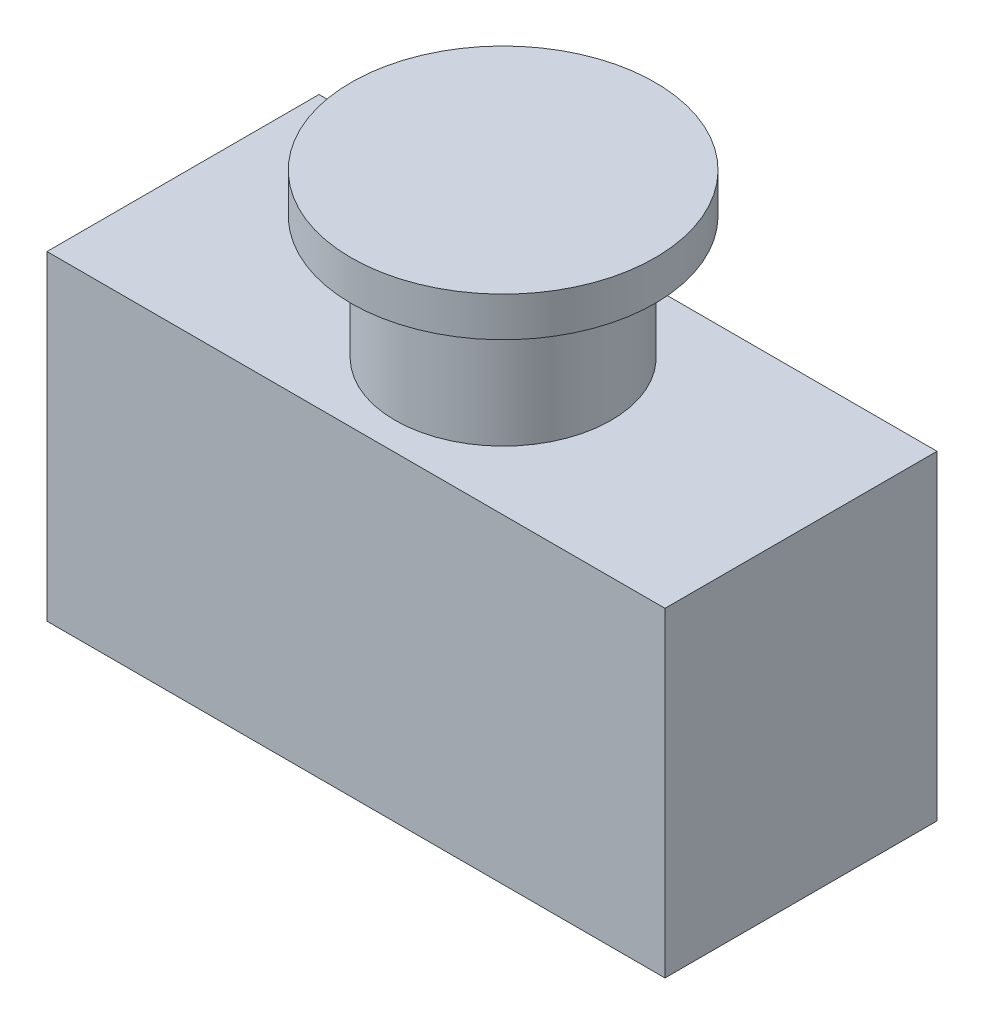
from build123d import *

# Parameters (mm, degrees)
SKETCH1_W      = 309.88
SKETCH1_H      = 136.398
EXTRUDE1_DEPTH = 160.528
SKETCH2_R      = 54.23826071
EXTRUDE2_DEPTH = 81.534
SKETCH3_R      = 76.2
EXTRUDE3_DEPTH = 19.812


with BuildPart() as part:
    # Sketch1 → Extrude1 (new body)
    with BuildSketch(Plane(origin=(0, 0, 0), x_dir=(1, 0, 0), z_dir=(0, 1, 0))):
        with Locations((120.827186097, -35.645984436)):
            Rectangle(SKETCH1_W, SKETCH1_H)
    extrude(amount=EXTRUDE1_DEPTH)

    # Sketch2 → Extrude2 (add)
    with BuildSketch(Plane(origin=(0, 160.528, 0), x_dir=(1, 0, 0), z_dir=(0, 1, 0))):
        with Locations((126.415186097, -35.645984436)):
            Circle(SKETCH2_R)
    extrude(amount=EXTRUDE2_DEPTH)

    # Sketch3 → Extrude3 (add)
    with BuildSketch(Plane(origin=(0, 242.062, 0), x_dir=(1, 0, 0), z_dir=(0, 1, 0))):
        with Locations((126.415186097, -35.645984436)):
            Circle(SKETCH3_R)
    extrude(amount=-EXTRUDE3_DEPTH)


solid = part.part
